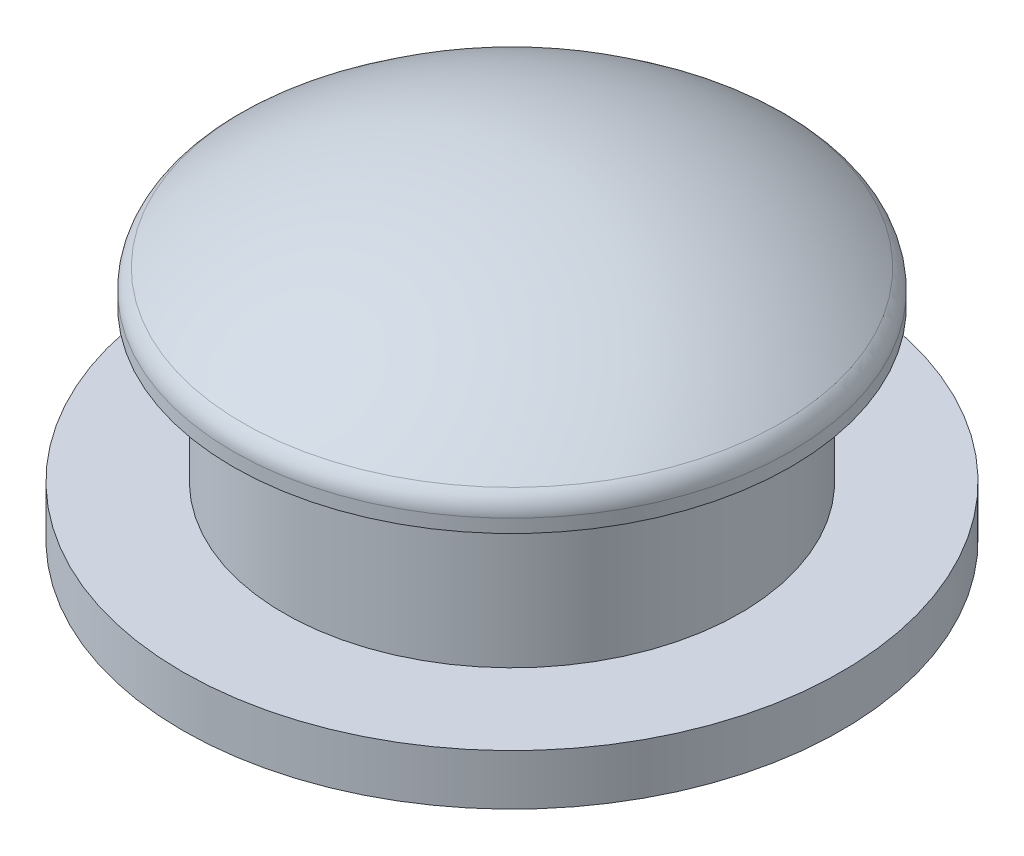
from build123d import *

# Parameters (mm, degrees)
D_ME1_FACE_RADIUS = 5.5
D_ME1_HEIGHT      = 2
CONG_1_R          = 0.5
CONG_2_R          = 2


# Read off the part's stored shape, not the designer's step: Coque1
with BuildPart() as part:
    # Esquisse1 → Révolution1 (revolve)
    with BuildSketch(Plane.XY, mode=Mode.PRIVATE) as r_volution1_sk:
        Polygon((0, 0), (0, 4.5), (5.5, 4.5), (5.5, 4), (4.5, 4), (4.5, 1), (6.5, 1), (6.5, 0), align=None)
    revolve(r_volution1_sk.sketch.rotate(Axis((0, 0, 0), (0, 1, 0)), 90), axis=Axis((0, 0, 0), (0, 1, 0)))

    # Dôme1: a dome of height H over a round flat face of radius A is a cap of a sphere of radius (A * A + H * H) / (2 * H)
    d_me1_r = (D_ME1_FACE_RADIUS * D_ME1_FACE_RADIUS + D_ME1_HEIGHT * D_ME1_HEIGHT) / (2 * D_ME1_HEIGHT)
    d_me1_base = Plane((0, 4.5, 0), z_dir=(0, 1, 0))
    with Locations(d_me1_base.offset(D_ME1_HEIGHT - d_me1_r)):
        d_me1_ball = Sphere(d_me1_r, mode=Mode.PRIVATE)
    add(split(d_me1_ball, bisect_by=d_me1_base, keep=Keep.TOP, mode=Mode.PRIVATE))

    # Congé1
    cong_1_edges = [part.edges().sort_by_distance(p)[0] for p in [
        (5.5, 4.5, 0),
    ]]
    fillet(cong_1_edges, radius=CONG_1_R)

    # Coque1 outline → Coque1 (revolve, cut)
    with BuildSketch(Plane.XY):
        with BuildLine():
            Line((3.5, 0), (3.500000007, 4.641335186))
            ThreePointArc((3.500000007, 4.641335186), (1.801895205, 5.282197402), (0, 5.5))
            Line((0, 5.5), (0, 0))
            Line((0, 0), (3.5, 0))
        make_face()
    revolve(axis=Axis((0, 0, 0), (0, 1, 0)), mode=Mode.SUBTRACT)

    # Congé2
    cong_2_edges = [part.edges().sort_by_distance(p)[0] for p in [
        (-3.5, 0, 0),
    ]]
    fillet(cong_2_edges, radius=CONG_2_R)


solid = part.part
